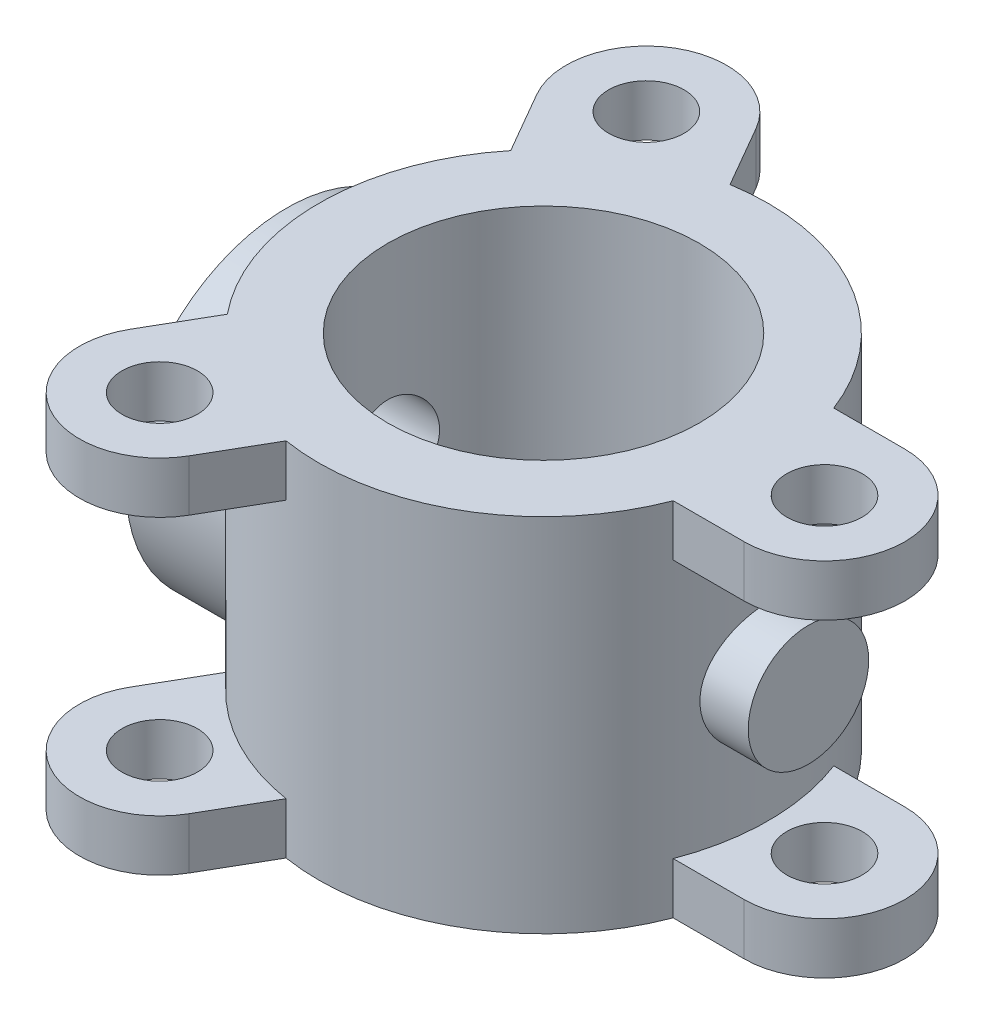
from build123d import *
from build123d.topology import SkipClean

# Parameters (mm, degrees)
SKETCH1_R                = 97
SKETCH1_R_2              = 23.5
BOSS_EXTRUDE1_DEPTH      = 16
BOSS_EXTRUDE2_START      = -225
SKETCH2_R                = 140
BOSS_EXTRUDE2_DEPTH      = 225
SKETCH3_R                = 97
CUT_EXTRUDE1_DEPTH       = 225
CUT_EXTRUDE3_DEPTH       = 263
CUT_EXTRUDE3_DEPTH_BACK  = 68
SKETCH5_R                = 28.1
BOSS_EXTRUDE3_DEPTH      = 6
BOSS_EXTRUDE3_DEPTH_BACK = 60
SKETCH6_R                = 100
SKETCH6_R_2              = 50
SKETCH6_R_3              = 10.15
CUT_EXTRUDE4_DEPTH       = 689
CUT_EXTRUDE4_DEPTH_BACK  = 43
BOSS_EXTRUDE4_REACH      = 484.214
BOSS_EXTRUDE4_END_RADIUS = 97
SKETCH10_R               = 50
SKETCH11_R               = 50
CUT_EXTRUDE5_DEPTH       = 25
SKETCH12_R               = 28.1
CUT_EXTRUDE6_DEPTH       = 285
BOSS_EXTRUDE5_REACH      = 437.81
BOSS_EXTRUDE5_END_RADIUS = 140
SKETCH13_R               = 37.5


with BuildPart() as part:
    # Sketch1 → Boss-Extrude1 (new, symmetric)
    with BuildSketch(Plane(origin=(0, 0, 0), x_dir=(1, 0, 0), z_dir=(0, 1, 0))):
        with BuildLine():
            Line((-44.198729811, -176.554445662), (-22.082213964, -138.247516529))
            ThreePointArc((-22.082213964, -138.247516529), (70, -121.24355653), (130.766968306, -50))
            Line((130.766968306, -50), (175, -50))
            ThreePointArc((175, -50), (225, 0), (175, 50))
            Line((175, 50), (130.766968306, 50))
            ThreePointArc((130.766968306, 50), (70, 121.24355653), (-22.082213964, 138.247516529))
            Line((-22.082213964, 138.247516529), (-44.198729811, 176.554445662))
            ThreePointArc((-44.198729811, 176.554445662), (-112.5, 194.855715851), (-130.801270189, 126.554445662))
            Line((-130.801270189, 126.554445662), (-108.684754342, 88.247516529))
            ThreePointArc((-108.684754342, 88.247516529), (-140, 0), (-108.684754342, -88.247516529))
            Line((-108.684754342, -88.247516529), (-130.801270189, -126.554445662))
            ThreePointArc((-130.801270189, -126.554445662), (-112.5, -194.855715851), (-44.198729811, -176.554445662))
        make_face()
        Circle(SKETCH1_R, mode=Mode.SUBTRACT)
        with Locations((175, 0)):
            Circle(SKETCH1_R_2, mode=Mode.SUBTRACT)
        with Locations((-87.5, -151.554445662)):
            Circle(SKETCH1_R_2, mode=Mode.SUBTRACT)
        with Locations((-87.5, 151.554445662)):
            Circle(SKETCH1_R_2, mode=Mode.SUBTRACT)
    boss_extrude1 = extrude(amount=BOSS_EXTRUDE1_DEPTH, both=True)

    # Sketch2 → Boss-Extrude2 (add)
    with SkipClean():  # the faces are left unmerged after this step: merging them gives an invalid solid
        with BuildSketch(Plane(origin=(0, -16, 0), x_dir=(-1, 0, 0), z_dir=(0, -1, 0)).offset(BOSS_EXTRUDE2_START)):
            Circle(SKETCH2_R)
        extrude(amount=BOSS_EXTRUDE2_DEPTH)

    # Mirror6: Boss-Extrude1 across plane
    with SkipClean():  # the faces are left unmerged after this step: merging them gives an invalid solid
        add(boss_extrude1.mirror(Plane(origin=(0, 96.5, 0), x_dir=(0, 0, 1), z_dir=(0, -1, 0))))

    # Sketch3 → Cut-Extrude1 (cut)
    with SkipClean():  # the faces are left unmerged after this step: merging them gives an invalid solid
        with BuildSketch(Plane(origin=(0, 209, 0), x_dir=(1, 0, 0), z_dir=(0, 1, 0))):
            Circle(SKETCH3_R)
        extrude(amount=-CUT_EXTRUDE1_DEPTH, mode=Mode.SUBTRACT)

    # Sketch5 → Cut-Extrude3 (cut, two sides: drawn at the far end of the back side and taken through both)
    with SkipClean():  # the faces are left unmerged after this step: merging them gives an invalid solid
        with BuildSketch(Plane(origin=(-100, 0, 0), x_dir=(0, 0, -1), z_dir=(1, 0, 0)).offset(-CUT_EXTRUDE3_DEPTH_BACK)):
            with Locations((0, 96.5)):
                Circle(SKETCH5_R)
        extrude(amount=CUT_EXTRUDE3_DEPTH + CUT_EXTRUDE3_DEPTH_BACK, mode=Mode.SUBTRACT)

    # Sketch6 → Boss-Extrude3 (add, two sides: drawn at the far end of the back side and taken through both)
    with SkipClean():  # the faces are left unmerged after this step: merging them gives an invalid solid
        with BuildSketch(Plane(origin=(-100, 0, 0), x_dir=(0, 0, -1), z_dir=(1, 0, 0)).offset(-BOSS_EXTRUDE3_DEPTH_BACK)):
            with Locations((0, 96.5)):
                Circle(SKETCH6_R)
            with Locations((0, 96.5)):
                Circle(SKETCH6_R_2, mode=Mode.SUBTRACT)
            with Locations((0, 171.5)):
                Circle(SKETCH6_R_3, mode=Mode.SUBTRACT)
            with Locations((64.951905284, 59)):
                Circle(SKETCH6_R_3, mode=Mode.SUBTRACT)
            with Locations((-64.951905284, 59)):
                Circle(SKETCH6_R_3, mode=Mode.SUBTRACT)
        extrude(amount=BOSS_EXTRUDE3_DEPTH + BOSS_EXTRUDE3_DEPTH_BACK)

    # Sketch8 → Cut-Extrude4 (cut, two sides: drawn at the far end of the back side and taken through both)
    with SkipClean():  # the faces are left unmerged after this step: merging them gives an invalid solid
        with BuildSketch(Plane(origin=(0, 0, 0), x_dir=(1, 0, 0), z_dir=(0, 1, 0)).offset(-CUT_EXTRUDE4_DEPTH_BACK)):
            with BuildLine():
                Line((-94, -23.937418407), (-94, 23.937418407))
                ThreePointArc((-94, 23.937418407), (-97, 0), (-94, -23.937418407))
            make_face()
        extrude(amount=CUT_EXTRUDE4_DEPTH + CUT_EXTRUDE4_DEPTH_BACK, mode=Mode.SUBTRACT)

    # Boss-Extrude4: up to this cylinder (the profile starts outside it)
    with SkipClean():  # the faces are left unmerged after this step: merging them gives an invalid solid
        boss_extrude4_end = Plane(origin=(0, 96.5, 0), z_dir=(0, 1, 0)) * Cylinder(BOSS_EXTRUDE4_END_RADIUS, 1163.428, mode=Mode.PRIVATE)
        # Sketch10 → Boss-Extrude4 (add, up to the surface)
        with BuildSketch(Plane.ZY.offset(160), mode=Mode.PRIVATE) as boss_extrude4_sk1:
            with Locations((0, 96.5)):
                Circle(SKETCH10_R)
        boss_extrude4_tool1 = extrude(boss_extrude4_sk1.sketch, amount=-BOSS_EXTRUDE4_REACH, mode=Mode.PRIVATE) - boss_extrude4_end
        add(boss_extrude4_tool1.solids().sort_by_distance((-160, 96.5, 0))[0])

    # Sketch11 → Cut-Extrude5 (cut)
    with SkipClean():  # the faces are left unmerged after this step: merging them gives an invalid solid
        with BuildSketch(Plane.ZY.offset(160)):
            with Locations((0, 96.5)):
                Circle(SKETCH11_R)
        extrude(amount=-CUT_EXTRUDE5_DEPTH, mode=Mode.SUBTRACT)

    # Sketch12 → Cut-Extrude6 (cut)
    with SkipClean():  # the faces are left unmerged after this step: merging them gives an invalid solid
        with BuildSketch(Plane.ZY.offset(135)):
            with Locations((0, 96.5)):
                Circle(SKETCH12_R)
        extrude(amount=-CUT_EXTRUDE6_DEPTH, mode=Mode.SUBTRACT)

    # Boss-Extrude5: up to this cylinder (the profile starts outside it)
    with SkipClean():  # the faces are left unmerged after this step: merging them gives an invalid solid
        boss_extrude5_end = Plane(origin=(0, 96.5, 0), z_dir=(0, -1, 0)) * Cylinder(BOSS_EXTRUDE5_END_RADIUS, 1156.62, mode=Mode.PRIVATE)
        # Sketch13 → Boss-Extrude5 (add, up to the surface)
        with BuildSketch(Plane.ZY.offset(-165), mode=Mode.PRIVATE) as boss_extrude5_sk1:
            with Locations((0, 96.5)):
                Circle(SKETCH13_R)
        boss_extrude5_tool1 = extrude(boss_extrude5_sk1.sketch, amount=BOSS_EXTRUDE5_REACH, mode=Mode.PRIVATE) - boss_extrude5_end
        add(boss_extrude5_tool1.solids().sort_by_distance((165, 96.5, 0))[0])


solid = part.part
